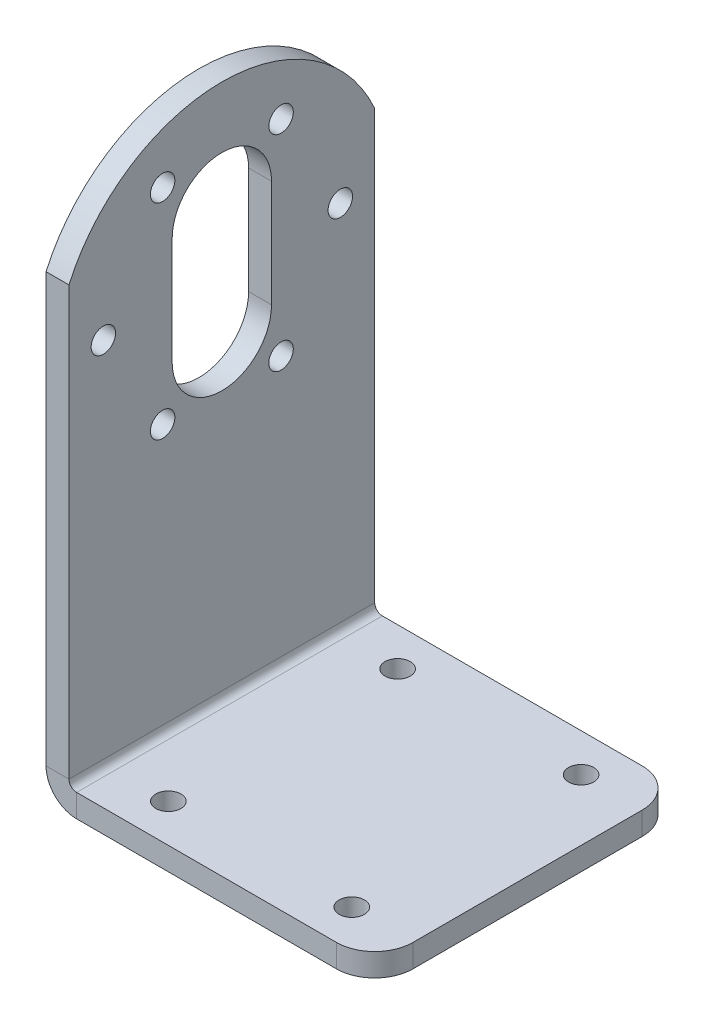
from build123d import *

# Parameters (mm, degrees)
SM_BASE_FLANGE_1_DEPTH      = 40
CUT_EXTRUDE_3_DEPTH         = 10
CUT_EXTRUDE_1_DEPTH         = 92.372862492
SKETCH_7_R                  = 1.6
CUT_EXTRUDE_2_DEPTH         = 92.372862492
SKETCH_9_R                  = 1.65
CUT_EXTRUDE_4_DEPTH         = 93.352585237
PATTERN_LINEAR_1_COUNT      = 2
PATTERN_LINEAR_1_PITCH      = 30
PATTERN_LINEAR_1_COUNT_DIR2 = 2
PATTERN_LINEAR_1_PITCH_DIR2 = 24
FILLET_1_R                  = 5


# Sheet-metal steps are written as plain solids
with BuildPart() as part:
    # Sketch 1 → 基材-凸緣1 (new body)
    with BuildSketch(Plane.XY):
        with BuildLine():
            Line((40, 0), (1, 0))
            ThreePointArc((1, 0), (0.292893219, 0.292893219), (0, 1))
            Line((0, 1), (0, 70))
            Line((0, 70), (-3, 70))
            Line((-3, 70), (-3, 1))
            ThreePointArc((-3, 1), (-1.828427125, -1.828427125), (1, -3))
            Line((1, -3), (40, -3))
            Line((40, -3), (40, 0))
        make_face()
    extrude(amount=SM_BASE_FLANGE_1_DEPTH)

    # 草圖8 → 除料-伸長3 (cut)
    with BuildSketch(Plane.ZY.offset(3)):
        with BuildLine():
            Line((0, 70), (0, 57.002788981))
            ThreePointArc((0, 57.002788981), (8.073899482, 66.465261916), (20, 70))
            Line((20, 70), (0, 70))
        make_face()
        with BuildLine():
            ThreePointArc((20, 70), (31.926100518, 66.465261916), (40, 57.002788981))
            Line((40, 57.002788981), (40, 70))
            Line((40, 70), (20, 70))
        make_face()
    extrude(amount=-CUT_EXTRUDE_3_DEPTH, mode=Mode.SUBTRACT)

    # 草圖6 → 除料-伸長1 (cut, through all)
    with BuildSketch(Plane.ZY.offset(3)):
        with BuildLine():
            Line((26.5, 55.5), (26.5, 41.5))
            ThreePointArc((26.5, 41.5), (20, 35), (13.5, 41.5))
            Line((13.5, 41.5), (13.5, 55.5))
            ThreePointArc((13.5, 55.5), (20, 62), (26.5, 55.5))
        make_face()
    extrude(amount=-CUT_EXTRUDE_1_DEPTH, mode=Mode.SUBTRACT)

    # 草圖7 → 除料-伸長2 (cut, through all)
    with BuildSketch(Plane.ZY.offset(3)):
        with Locations((4.5, 48.5)):
            Circle(SKETCH_7_R)
        with Locations((12.25, 35.076606241)):
            Circle(SKETCH_7_R)
        with Locations((27.75, 35.076606241)):
            Circle(SKETCH_7_R)
        with Locations((35.5, 48.5)):
            Circle(SKETCH_7_R)
        with Locations((27.75, 61.923393759)):
            Circle(SKETCH_7_R)
        with Locations((12.25, 61.923393759)):
            Circle(SKETCH_7_R)
    extrude(amount=-CUT_EXTRUDE_2_DEPTH, mode=Mode.SUBTRACT)

    # 草圖9 → 除料-伸長4 (cut, through all)
    with BuildSketch(Plane.XZ.offset(3)):
        with Locations(Location((32, 35, 0), (0, 0, 270))):
            Circle(SKETCH_9_R)
    cut_extrude_4 = extrude(amount=-CUT_EXTRUDE_4_DEPTH, mode=Mode.SUBTRACT)

    # 直線複製排列1: Cut-Extrude 4 2 × 2
    with Locations(*[(-j * PATTERN_LINEAR_1_PITCH_DIR2, 0, -i * PATTERN_LINEAR_1_PITCH) for i in range(PATTERN_LINEAR_1_COUNT) for j in range(PATTERN_LINEAR_1_COUNT_DIR2) if (i, j) != (0, 0)]):
        add(cut_extrude_4, mode=Mode.SUBTRACT)

    # 圓角1
    fillet_1_edges = [part.edges().sort_by_distance(p)[0] for p in [
        (40, -1.5, 40),
        (40, -1.5, 0),
    ]]
    fillet(fillet_1_edges, radius=FILLET_1_R)


solid = part.part
